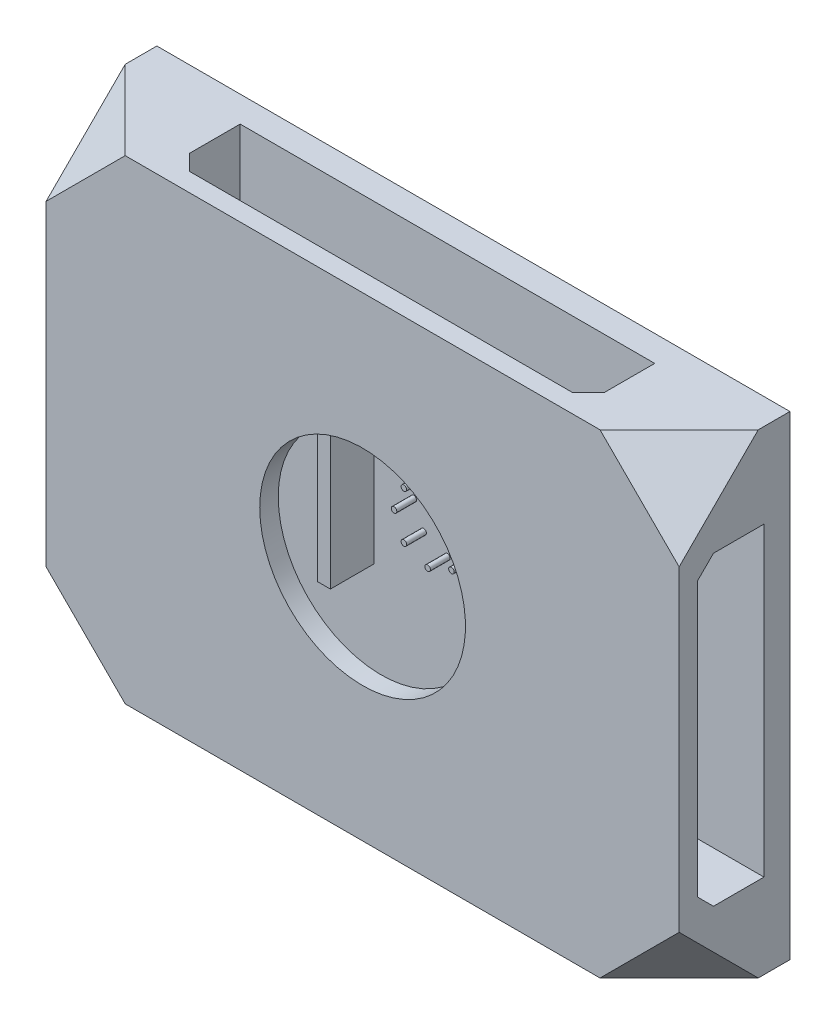
from build123d import *

# Parameters (mm, degrees)
SKETCH_4_W           = 400
SKETCH_4_H           = 300
EXTRUDE_1_DEPTH      = 150
SKETCH_5_R           = 48.25
CUT_EXTRUDE_1_DEPTH  = 42.3
SKETCH_6_W           = 96.5
SKETCH_6_H           = 19.3
CUT_EXTRUDE_2_DEPTH  = 391.512483795
CUT_EXTRUDE_3_DEPTH  = 453.769256907
SKETCH_8_W           = 326
SKETCH_8_H           = 226
CUT_EXTRUDE_5_DEPTH  = 10
SKETCH_9_R           = 48.25
CUT_EXTRUDE_6_DEPTH  = 10
CHAMFER_START        = 259.807621135
CHAMFER_1_OUTLINE_W  = 65
CHAMFER_1_OUTLINE_H  = 74
CHAMFER_1_DEPTH      = 30.192378865
CHAMFER_START_2      = -290
CHAMFER_2_OUTLINE_W  = 64
CHAMFER_2_OUTLINE_H  = 74
CHAMFER_2_DEPTH      = 30.192378865
CHAMFER_3_OUTLINE_W  = 64
CHAMFER_3_OUTLINE_H  = 74
CHAMFER_3_DEPTH      = 30.192378865
CHAMFER_4_OUTLINE_W  = 65
CHAMFER_4_OUTLINE_H  = 74
CHAMFER_4_DEPTH      = 30.192378865
SKETCH_10_W          = 400
SKETCH_10_H          = 50
CUT_EXTRUDE_7_DEPTH  = 391.512483795
SKETCH_11_W          = 340
SKETCH_11_H          = 240
CUT_EXTRUDE_8_DEPTH  = 10
SKETCH_12_W          = 400
SKETCH_12_H          = 30
CUT_EXTRUDE_9_DEPTH  = 391.512483795
SKETCH_13_W          = 41.9021645
SKETCH_13_H          = 193.164300696
SKETCH_13_W_2        = 19.3
SKETCH_13_H_2        = 96.5
CUT_EXTRUDE_10_DEPTH = 453.769256907
SKETCH_14_W          = 261.947815576
SKETCH_14_H          = 41.9021645
SKETCH_14_W_2        = 96.5
SKETCH_14_H_2        = 19.3
CUT_EXTRUDE_11_DEPTH = 391.512483795
SKETCH_16_R          = 65
SKETCH_16_R_2        = 48.25
CUT_EXTRUDE_12_DEPTH = 257.708036866
CHAMFER_5_SIZE       = 10
SKETCH_17_W          = 10
SKETCH_17_H          = 96.5
EXTRUDE_4_DEPTH      = 27.7
SKETCH_19_R          = 1.75
EXTRUDE_6_DEPTH      = 12.5
SKETCH_20_W          = 2
SKETCH_20_H          = 27.7
CUT_EXTRUDE_13_DEPTH = 320.065921872
CHAMFER_6_SIZE       = 8
SKETCH_21_W          = 327.675165592
SKETCH_21_H          = 227.528194438
CUT_EXTRUDE_14_DEPTH = 3


with BuildPart() as part:
    # 草图4 → 凸台-拉伸1 (new body)
    with BuildSketch(Plane.XY):
        Rectangle(SKETCH_4_W, SKETCH_4_H)
    extrude(amount=EXTRUDE_1_DEPTH)

    # 草图5 → 切除-拉伸1 (cut)
    with BuildSketch(Plane.XY.offset(150)):
        Circle(SKETCH_5_R)
    extrude(amount=-CUT_EXTRUDE_1_DEPTH, mode=Mode.SUBTRACT)

    # 草图6 → 切除-拉伸2 (cut, through all)
    with BuildSketch(Plane.XZ.offset(150)):
        with Locations((0, 117.35)):
            Rectangle(SKETCH_6_W, SKETCH_6_H)
    extrude(amount=-CUT_EXTRUDE_2_DEPTH, mode=Mode.SUBTRACT)

    # 草图7 → 切除-拉伸3 (cut, through all)
    with BuildSketch(Plane.ZY.offset(200)):
        Polygon((127, -48.25), (107.7, -48.25), (107.7, 48.25), (127, 48.25), (127, 0), align=None)
    extrude(amount=-CUT_EXTRUDE_3_DEPTH, mode=Mode.SUBTRACT)

    # 草图8 → 切除-拉伸5 (cut)
    with BuildSketch(Plane(origin=(0, 0, 0), x_dir=(-1, 0, 0), z_dir=(0, 0, -1))):
        Rectangle(SKETCH_8_W, SKETCH_8_H)
    extrude(amount=-CUT_EXTRUDE_5_DEPTH, mode=Mode.SUBTRACT)

    # 草图9 → 切除-拉伸6 (cut)
    with BuildSketch(Plane.XY.offset(107.7)):
        Circle(SKETCH_9_R)
    extrude(amount=-CUT_EXTRUDE_6_DEPTH, mode=Mode.SUBTRACT)

    # 倒角1: read off the stored shape, not the designer's step
    # 倒角1 outline → 倒角1 (cut)
    with BuildSketch(Plane(origin=(0, 0, 0), x_dir=(0.8164965809277258, -0.40824829046386313, -0.40824829046386313), z_dir=(0.5773502691896258, 0.5773502691896258, 0.5773502691896258)).offset(CHAMFER_START)):
        with Locations((30.5, 0)):
            Rectangle(CHAMFER_1_OUTLINE_W, CHAMFER_1_OUTLINE_H)
    extrude(amount=CHAMFER_1_DEPTH, mode=Mode.SUBTRACT)

    # 倒角2: read off the stored shape, not the designer's step
    # 倒角2 outline → 倒角2 (cut)
    with BuildSketch(Plane(origin=(0, 0, 0), x_dir=(0.8164965809277258, 0.40824829046386313, 0.40824829046386313), z_dir=(0.5773502691896258, -0.5773502691896258, -0.5773502691896258)).offset(CHAMFER_START_2)):
        with Locations((-31, 0)):
            Rectangle(CHAMFER_2_OUTLINE_W, CHAMFER_2_OUTLINE_H)
    extrude(amount=CHAMFER_2_DEPTH, mode=Mode.SUBTRACT)

    # 倒角3: read off the stored shape, not the designer's step
    # 倒角3 outline → 倒角3 (cut)
    with BuildSketch(Plane(origin=(0, 0, 0), x_dir=(0.8164965809277258, -0.40824829046386313, 0.40824829046386313), z_dir=(0.5773502691896258, 0.5773502691896258, -0.5773502691896258)).offset(CHAMFER_START_2)):
        with Locations((-31, 0)):
            Rectangle(CHAMFER_3_OUTLINE_W, CHAMFER_3_OUTLINE_H)
    extrude(amount=CHAMFER_3_DEPTH, mode=Mode.SUBTRACT)

    # 倒角4: read off the stored shape, not the designer's step
    # 倒角4 outline → 倒角4 (cut)
    with BuildSketch(Plane(origin=(0, 0, 0), x_dir=(0.8164965809277258, 0.40824829046386313, -0.40824829046386313), z_dir=(0.5773502691896258, -0.5773502691896258, 0.5773502691896258)).offset(CHAMFER_START)):
        with Locations((30.5, 0)):
            Rectangle(CHAMFER_4_OUTLINE_W, CHAMFER_4_OUTLINE_H)
    extrude(amount=CHAMFER_4_DEPTH, mode=Mode.SUBTRACT)

    # 草图10 → 切除-拉伸7 (cut, through all)
    with BuildSketch(Plane(origin=(0, 150, 0), x_dir=(1, 0, 0), z_dir=(0, 1, 0))):
        with Locations((0, -25)):
            Rectangle(SKETCH_10_W, SKETCH_10_H)
    extrude(amount=-CUT_EXTRUDE_7_DEPTH, mode=Mode.SUBTRACT)

    # 草图11 → 切除-拉伸8 (cut)
    with BuildSketch(Plane(origin=(0, 0, 50), x_dir=(-1, 0, 0), z_dir=(0, 0, -1))):
        Rectangle(SKETCH_11_W, SKETCH_11_H)
    extrude(amount=-CUT_EXTRUDE_8_DEPTH, mode=Mode.SUBTRACT)

    # 草图12 → 切除-拉伸9 (cut, through all)
    with BuildSketch(Plane(origin=(0, 150, 0), x_dir=(1, 0, 0), z_dir=(0, 1, 0))):
        with Locations((0, -65)):
            Rectangle(SKETCH_12_W, SKETCH_12_H)
    extrude(amount=-CUT_EXTRUDE_9_DEPTH, mode=Mode.SUBTRACT)

    # 草图13 → 切除-拉伸10 (cut, through all)
    with BuildSketch(Plane(origin=(200, 0, 0), x_dir=(0, 0, -1), z_dir=(1, 0, 0))):
        with Locations((-117.35, 0)):
            Rectangle(SKETCH_13_W, SKETCH_13_H)
        with Locations((-117.35, 0)):
            Rectangle(SKETCH_13_W_2, SKETCH_13_H_2, mode=Mode.SUBTRACT)
    extrude(amount=-CUT_EXTRUDE_10_DEPTH, mode=Mode.SUBTRACT)

    # 草图14 → 切除-拉伸11 (cut, through all)
    with BuildSketch(Plane.XZ.offset(150)):
        with Locations((0, 117.35)):
            Rectangle(SKETCH_14_W, SKETCH_14_H)
        with Locations((0, 117.35)):
            Rectangle(SKETCH_14_W_2, SKETCH_14_H_2, mode=Mode.SUBTRACT)
    extrude(amount=-CUT_EXTRUDE_11_DEPTH, mode=Mode.SUBTRACT)

    # 草图16 → 切除-拉伸12 (cut, through all)
    with BuildSketch(Plane(origin=(0, 0, 138.30108225), x_dir=(-1, 0, 0), z_dir=(0, 0, -1))):
        Circle(SKETCH_16_R)
        Circle(SKETCH_16_R_2, mode=Mode.SUBTRACT)
    extrude(amount=-CUT_EXTRUDE_12_DEPTH, mode=Mode.SUBTRACT)

    # 倒角5
    chamfer_5_edges = [part.edges().sort_by_distance(p)[0] for p in [
        (-165.486953894, -96.582150348, 138.30108225),
        (-165.486953894, 96.582150348, 138.30108225),
        (165.486953894, -96.582150348, 138.30108225),
        (165.486953894, 96.582150348, 138.30108225),
        (-130.973907788, 123.291075174, 138.30108225),
        (130.973907788, 123.291075174, 138.30108225),
        (130.973907788, -123.291075174, 138.30108225),
        (-130.973907788, -123.291075174, 138.30108225),
    ]]
    chamfer(chamfer_5_edges, length=CHAMFER_5_SIZE)

    # 草图17 → 凸台-拉伸4 (add)
    with BuildSketch(Plane.XY.offset(96.39891775)):
        with Locations((49.25, 0)):
            Rectangle(SKETCH_17_W, SKETCH_17_H)
        with Locations((-49.25, 0)):
            Rectangle(SKETCH_17_W, SKETCH_17_H)
    extrude(amount=EXTRUDE_4_DEPTH)

    # 草图19 → 凸台-拉伸6 (add)
    with BuildSketch(Plane.XY.offset(96.39891775)):
        with Locations(Location((-15.0260191, -15.0260191, 0), (0, 0, 180))):
            Circle(SKETCH_19_R)
        with Locations(Location((-21.25, 0, 0), (0, 0, 180))):
            Circle(SKETCH_19_R)
        with Locations(Location((-15.0260191, 15.0260191, 0), (0, 0, 180))):
            Circle(SKETCH_19_R)
        with Locations(Location((15.0260191, 15.0260191, 0), (0, 0, 180))):
            Circle(SKETCH_19_R)
        with Locations(Location((21.25, 0, 0), (0, 0, 180))):
            Circle(SKETCH_19_R)
        with Locations(Location((15.0260191, -15.0260191, 0), (0, 0, 180))):
            Circle(SKETCH_19_R)
        with Locations(Location((0, -21.25, 0), (0, 0, 180))):
            Circle(SKETCH_19_R)
        with Locations(Location((0, 21.25, 0), (0, 0, 180))):
            Circle(SKETCH_19_R)
    extrude(amount=EXTRUDE_6_DEPTH)

    # 草图20 → 切除-拉伸13 (cut, through all)
    with BuildSketch(Plane.XZ.offset(48.25)):
        with Locations((-45.25, 110.24891775)):
            Rectangle(SKETCH_20_W, SKETCH_20_H)
        with Locations((45.25, 110.24891775)):
            Rectangle(SKETCH_20_W, SKETCH_20_H)
    extrude(amount=-CUT_EXTRUDE_13_DEPTH, mode=Mode.SUBTRACT)

    # 倒角6
    chamfer_6_edges = [part.edges().sort_by_distance(p)[0] for p in [
        (54.25, 0, 96.39891775),
        (-54.25, 0, 96.39891775),
    ]]
    chamfer(chamfer_6_edges, length=CHAMFER_6_SIZE)

    # 草图21 → 切除-拉伸14 (cut)
    with BuildSketch(Plane(origin=(0, 0, 80), x_dir=(-1, 0, 0), z_dir=(0, 0, -1))):
        Rectangle(SKETCH_21_W, SKETCH_21_H)
    extrude(amount=-CUT_EXTRUDE_14_DEPTH, mode=Mode.SUBTRACT)


solid = part.part
